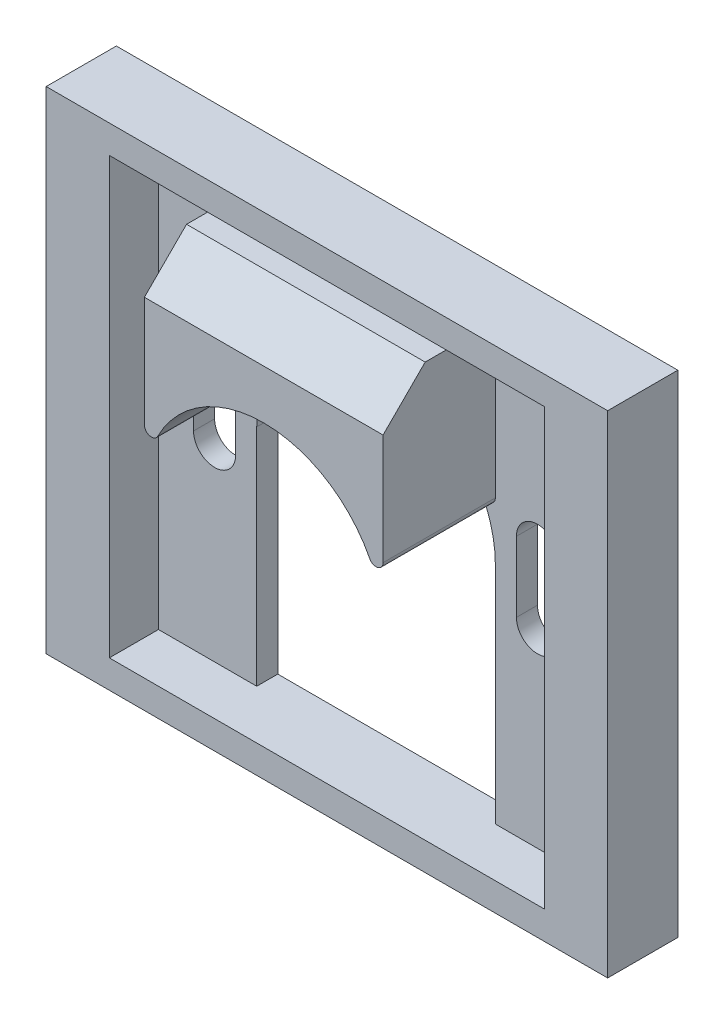
from build123d import *

# Parameters (mm, degrees)
SKETCH_1_W          = 40
SKETCH_1_H          = 30
EXTRUDE_1_DEPTH     = 5
SKETCH_2_W          = 31
SKETCH_2_H          = 28
CUT_EXTRUDE_1_DEPTH = 3.5
CUT_EXTRUDE_2_DEPTH = 26.243811123
EXTRUDE_START       = 8
EXTRUDE_2_DEPTH     = 8
FILLET_START        = 1.5
FILLET_1_DEPTH      = 8.5
CHAMFER_1_SIZE      = 3
EXTRUDE_3_DEPTH     = 5
SKETCH_7_W          = 7
SKETCH_7_H          = 3
EXTRUDE_4_DEPTH     = 1.5


with BuildPart() as part:
    # ｽｹｯﾁ1 → ﾎﾞｽ - 押し出し1 (new body)
    with BuildSketch(Plane.XY):
        Rectangle(SKETCH_1_W, SKETCH_1_H)
    extrude(amount=EXTRUDE_1_DEPTH)

    # ｽｹｯﾁ2 → ｶｯﾄ - 押し出し1 (cut)
    with BuildSketch(Plane.XY.offset(5)):
        with Locations((0, -1)):
            Rectangle(SKETCH_2_W, SKETCH_2_H)
    extrude(amount=-CUT_EXTRUDE_1_DEPTH, mode=Mode.SUBTRACT)

    # ｽｹｯﾁ3 → ｶｯﾄ - 押し出し2 (cut, through all)
    with BuildSketch(Plane.XY.offset(1.5)):
        with BuildLine():
            Line((8.5, -2), (8.5, -15))
            Line((8.5, -15), (-8.5, -15))
            Line((-8.5, -15), (-8.5, -2))
            ThreePointArc((-8.5, -2), (0, 6.5), (8.5, -2))
        make_face()
        with BuildLine():
            Line((13, -4.5), (13, 0.5))
            ThreePointArc((13, 0.5), (11.5, 2), (10, 0.5))
            Line((10, 0.5), (10, -4.5))
            ThreePointArc((10, -4.5), (11.5, -6), (13, -4.5))
        make_face()
        with BuildLine():
            Line((-13, -4.5), (-13, 0.5))
            ThreePointArc((-13, 0.5), (-11.5, 2), (-10, 0.5))
            Line((-10, 0.5), (-10, -4.5))
            ThreePointArc((-10, -4.5), (-11.5, -6), (-13, -4.5))
        make_face()
    extrude(amount=-CUT_EXTRUDE_2_DEPTH, mode=Mode.SUBTRACT)

    # ｽｹｯﾁ4 → ﾎﾞｽ - 押し出し2 (add)
    with BuildSketch(Plane.XY.offset(1.5).offset(EXTRUDE_START)):
        with BuildLine():
            Line((-8.5, -2), (-8.5, 13))
            Line((-8.5, 13), (8.5, 13))
            Line((8.5, 13), (8.5, -2))
            ThreePointArc((8.5, -2), (0, 6.5), (-8.5, -2))
        make_face()
    extrude(amount=-EXTRUDE_2_DEPTH)

    # ﾌｨﾚｯﾄ1: read off the stored shape, not the designer's step
    # ﾌｨﾚｯﾄ1 outline → ﾌｨﾚｯﾄ1 (cut)
    with BuildSketch(Plane.XY.offset(FILLET_START)):
        with BuildLine():
            ThreePointArc((8.5, 2.123105626), (8.117851131, 1.637192968), (7.555555556, 1.894044202))
            ThreePointArc((7.555555556, 1.894044202), (8.260515184, 0.003469213), (8.5, -2))
            Line((8.5, -2), (8.5, 2.123105626))
        make_face()
        with BuildLine():
            ThreePointArc((-7.555555556, 1.894044202), (-8.117851131, 1.637192968), (-8.5, 2.123105626))
            Line((-8.5, 2.123105626), (-8.5, -2))
            ThreePointArc((-8.5, -2), (-8.260515184, 0.003469213), (-7.555555556, 1.894044202))
        make_face()
    extrude(amount=FILLET_1_DEPTH, mode=Mode.SUBTRACT)

    # 面取り1
    chamfer_1_edges = [part.edges().sort_by_distance(p)[0] for p in [
        (0, 13, 9.5),
    ]]
    chamfer(chamfer_1_edges, length=CHAMFER_1_SIZE)

    # ｽｹｯﾁ5 → ﾎﾞｽ - 押し出し3 (add)
    with BuildSketch(Plane(origin=(0, 0, 0), x_dir=(-1, 0, 0), z_dir=(0, 0, -1))):
        Polygon((-15.5, -15), (-20, -15), (-20, -20), (20, -20), (20, -15), (15.5, -15), (15.5, -18), (8.5, -18), (-8.5, -18), (-15.5, -18), align=None)
    extrude(amount=-EXTRUDE_3_DEPTH)

    # ｽｹｯﾁ7 → ﾎﾞｽ - 押し出し4 (add)
    with BuildSketch(Plane(origin=(0, 0, 0), x_dir=(-1, 0, 0), z_dir=(0, 0, -1))):
        with Locations((12, -16.5)):
            Rectangle(SKETCH_7_W, SKETCH_7_H)
        with Locations((-12, -16.5)):
            Rectangle(SKETCH_7_W, SKETCH_7_H)
    extrude(amount=-EXTRUDE_4_DEPTH)


solid = part.part
